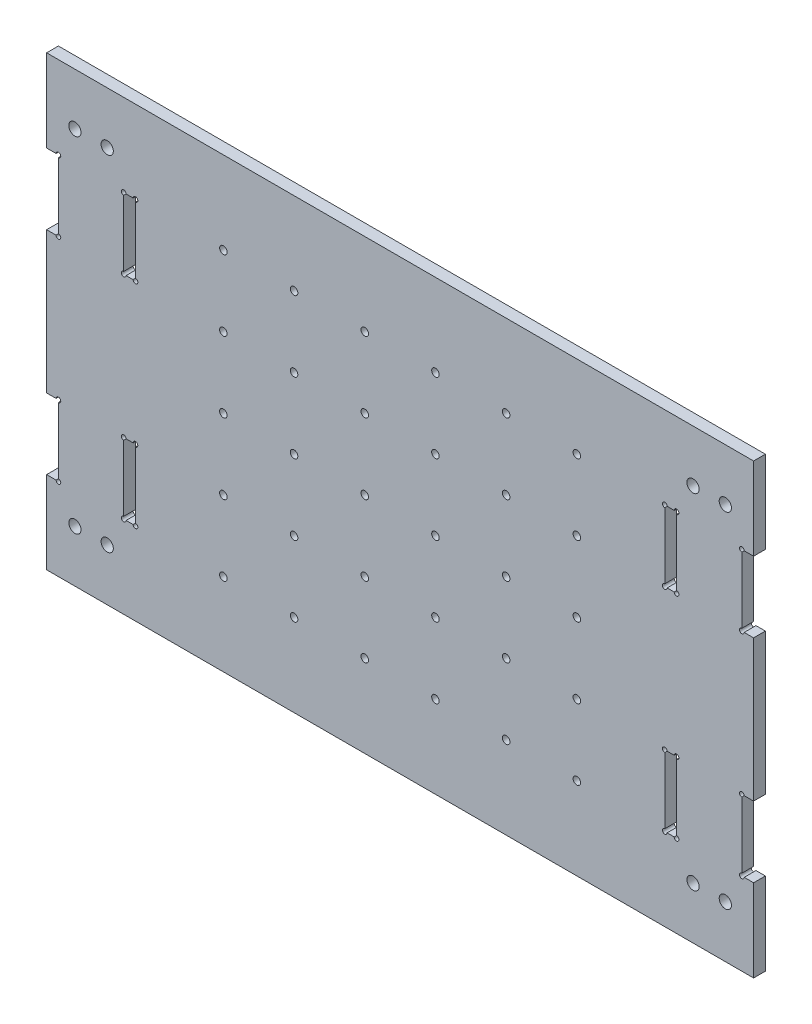
from build123d import *

# Parameters (mm, degrees)
EXTRUDE_2_DEPTH     = 5
SKETCH_2_W          = 5
SKETCH_2_H          = 30
CUT_EXTRUDE_1_DEPTH = 10
SKETCH_3_R          = 1
CUT_EXTRUDE_2_DEPTH = 10
EXTRUDE_3_REACH     = 316.046
SKETCH_4_W          = 5
SKETCH_4_H          = 50
CUT_EXTRUDE_3_DEPTH = 5
SKETCH_6_R          = 2.6
CUT_EXTRUDE_4_DEPTH = 356.140817142
SKETCH_7_R          = 1.6
CUT_EXTRUDE_5_DEPTH = 356.140817142


with BuildPart() as part:
    # 草图1 → 凸台-拉伸2 (new body)
    with BuildSketch(Plane.XY):
        Polygon((0, 0), (0, -190), (50, -190), (50, -140), (250, -140), (250, -190), (300, -190), (300, 0), (250, 0), (250, -50), (50, -50), (50, 0), align=None)
    extrude(amount=EXTRUDE_2_DEPTH)

    # 草图2 → 切除-拉伸1 (cut)
    with BuildSketch(Plane.XY.offset(5)):
        with Locations((2.5, -50)):
            Rectangle(SKETCH_2_W, SKETCH_2_H)
        with Locations((2.5, -140)):
            Rectangle(SKETCH_2_W, SKETCH_2_H)
        with Locations((297.5, -50)):
            Rectangle(SKETCH_2_W, SKETCH_2_H)
        with Locations((297.5, -140)):
            Rectangle(SKETCH_2_W, SKETCH_2_H)
    extrude(amount=-CUT_EXTRUDE_1_DEPTH, mode=Mode.SUBTRACT)

    # 草图3 → 切除-拉伸2 (cut)
    with BuildSketch(Plane.XY.offset(5)):
        with BuildLine():
            Line((5, -65), (4, -65))
            ThreePointArc((4, -65), (5.707106781, -65.707106781), (5, -64))
            Line((5, -64), (5, -65))
        make_face()
        with BuildLine():
            ThreePointArc((5, -126), (5.707106781, -124.292893219), (4, -125))
            Line((4, -125), (5, -125))
            Line((5, -125), (5, -126))
        make_face()
        with BuildLine():
            Line((295, -125), (296, -125))
            ThreePointArc((296, -125), (294.292893219, -124.292893219), (295, -126))
            Line((295, -126), (295, -125))
        make_face()
        with BuildLine():
            ThreePointArc((295, -64), (294.292893219, -65.707106781), (296, -65))
            Line((296, -65), (295, -65))
            Line((295, -65), (295, -64))
        make_face()
        with Locations((5, -35)):
            Circle(SKETCH_3_R)
        with BuildLine():
            ThreePointArc((4, -155), (5.707106781, -155.707106781), (5, -154))
            Line((5, -154), (5, -155))
            Line((5, -155), (4, -155))
        make_face()
        with BuildLine():
            Line((295, -155), (295, -154))
            ThreePointArc((295, -154), (294.292893219, -155.707106781), (296, -155))
            Line((296, -155), (295, -155))
        make_face()
        with BuildLine():
            ThreePointArc((296, -35), (294.292893219, -34.292893219), (295, -36))
            Line((295, -36), (295, -35))
            Line((295, -35), (296, -35))
        make_face()
    extrude(amount=-CUT_EXTRUDE_2_DEPTH, mode=Mode.SUBTRACT)

    # 草图4 → 凸台-拉伸3 (add, up to next)
    with BuildSketch(Plane(origin=(50, 0, 0), x_dir=(0, 0, -1), z_dir=(1, 0, 0)), mode=Mode.PRIVATE) as extrude_3_sk1:
        with Locations((-2.5, -25)):
            Rectangle(SKETCH_4_W, SKETCH_4_H)
    extrude_3_tool1 = extrude(extrude_3_sk1.sketch, amount=EXTRUDE_3_REACH, mode=Mode.PRIVATE) - part.part
    # 草图4 → 凸台-拉伸3 (add, up to next)
    with BuildSketch(Plane(origin=(50, 0, 0), x_dir=(0, 0, -1), z_dir=(1, 0, 0)), mode=Mode.PRIVATE) as extrude_3_sk2:
        with Locations((-2.5, -165)):
            Rectangle(SKETCH_4_W, SKETCH_4_H)
    extrude_3_tool2 = extrude(extrude_3_sk2.sketch, amount=EXTRUDE_3_REACH, mode=Mode.PRIVATE) - part.part
    add(extrude_3_tool1.solids().sort_by_distance((50, -25, 2.5))[0])
    add(extrude_3_tool2.solids().sort_by_distance((50, -165, 2.5))[0])

    # 草图5 → 切除-拉伸3 (cut)
    with BuildSketch(Plane.XY.offset(5)):
        with BuildLine():
            ThreePointArc((33.7, -35), (31.992893219, -34.292893219), (32.7, -36))
            Line((32.7, -36), (32.7, -64))
            ThreePointArc((32.7, -64), (31.992893219, -65.707106781), (33.7, -65))
            Line((33.7, -65), (36.7, -65))
            ThreePointArc((36.7, -65), (38.407106781, -65.707106781), (37.7, -64))
            Line((37.7, -64), (37.7, -36))
            ThreePointArc((37.7, -36), (38.407106781, -34.292893219), (36.7, -35))
            Line((36.7, -35), (33.7, -35))
        make_face()
        with BuildLine():
            ThreePointArc((33.7, -125), (31.992893219, -124.292893219), (32.7, -126))
            Line((32.7, -126), (32.7, -154))
            ThreePointArc((32.7, -154), (31.992893219, -155.707106781), (33.7, -155))
            Line((33.7, -155), (36.7, -155))
            ThreePointArc((36.7, -155), (38.407106781, -155.707106781), (37.7, -154))
            Line((37.7, -154), (37.7, -126))
            ThreePointArc((37.7, -126), (38.407106781, -124.292893219), (36.7, -125))
            Line((36.7, -125), (33.7, -125))
        make_face()
        with BuildLine():
            ThreePointArc((266.3, -155), (268.007106781, -155.707106781), (267.3, -154))
            Line((267.3, -154), (267.3, -126))
            ThreePointArc((267.3, -126), (268.007106781, -124.292893219), (266.3, -125))
            Line((266.3, -125), (263.3, -125))
            ThreePointArc((263.3, -125), (261.592893219, -124.292893219), (262.3, -126))
            Line((262.3, -126), (262.3, -154))
            ThreePointArc((262.3, -154), (261.592893219, -155.707106781), (263.3, -155))
            Line((263.3, -155), (266.3, -155))
        make_face()
        with BuildLine():
            ThreePointArc((262.3, -64), (261.592893219, -65.707106781), (263.3, -65))
            Line((263.3, -65), (266.3, -65))
            ThreePointArc((266.3, -65), (268.007106781, -65.707106781), (267.3, -64))
            Line((267.3, -64), (267.3, -36))
            ThreePointArc((267.3, -36), (268.007106781, -34.292893219), (266.3, -35))
            Line((266.3, -35), (263.3, -35))
            ThreePointArc((263.3, -35), (261.592893219, -34.292893219), (262.3, -36))
            Line((262.3, -36), (262.3, -64))
        make_face()
    extrude(amount=-CUT_EXTRUDE_3_DEPTH, mode=Mode.SUBTRACT)

    # 草图6 → 切除-拉伸4 (cut, through all)
    with BuildSketch(Plane.XY.offset(5)):
        with Locations((12, -168)):
            Circle(SKETCH_6_R)
        with Locations((25.7, -168)):
            Circle(SKETCH_6_R)
        with Locations((25.7, -22)):
            Circle(SKETCH_6_R)
        with Locations((12, -22)):
            Circle(SKETCH_6_R)
        with Locations((274.3, -168)):
            Circle(SKETCH_6_R)
        with Locations((288, -168)):
            Circle(SKETCH_6_R)
        with Locations((274.3, -22)):
            Circle(SKETCH_6_R)
        with Locations((288, -22)):
            Circle(SKETCH_6_R)
    extrude(amount=-CUT_EXTRUDE_4_DEPTH, mode=Mode.SUBTRACT)

    # 草图7 → 切除-拉伸5 (cut, through all)
    with BuildSketch(Plane.XY.offset(5)):
        with Locations((75, -35)):
            Circle(SKETCH_7_R)
        with Locations((105, -35)):
            Circle(SKETCH_7_R)
        with Locations((135, -35)):
            Circle(SKETCH_7_R)
        with Locations((165, -35)):
            Circle(SKETCH_7_R)
        with Locations((195, -35)):
            Circle(SKETCH_7_R)
        with Locations((225, -35)):
            Circle(SKETCH_7_R)
        with Locations((105, -65)):
            Circle(SKETCH_7_R)
        with Locations((135, -65)):
            Circle(SKETCH_7_R)
        with Locations((165, -65)):
            Circle(SKETCH_7_R)
        with Locations((195, -65)):
            Circle(SKETCH_7_R)
        with Locations((225, -65)):
            Circle(SKETCH_7_R)
        with Locations((105, -95)):
            Circle(SKETCH_7_R)
        with Locations((135, -95)):
            Circle(SKETCH_7_R)
        with Locations((165, -95)):
            Circle(SKETCH_7_R)
        with Locations((195, -95)):
            Circle(SKETCH_7_R)
        with Locations((225, -95)):
            Circle(SKETCH_7_R)
        with Locations((105, -125)):
            Circle(SKETCH_7_R)
        with Locations((135, -125)):
            Circle(SKETCH_7_R)
        with Locations((165, -125)):
            Circle(SKETCH_7_R)
        with Locations((195, -125)):
            Circle(SKETCH_7_R)
        with Locations((225, -125)):
            Circle(SKETCH_7_R)
        with Locations((105, -155)):
            Circle(SKETCH_7_R)
        with Locations((135, -155)):
            Circle(SKETCH_7_R)
        with Locations((165, -155)):
            Circle(SKETCH_7_R)
        with Locations((195, -155)):
            Circle(SKETCH_7_R)
        with Locations((225, -155)):
            Circle(SKETCH_7_R)
        with Locations((75, -65)):
            Circle(SKETCH_7_R)
        with Locations((75, -95)):
            Circle(SKETCH_7_R)
        with Locations((75, -125)):
            Circle(SKETCH_7_R)
        with Locations((75, -155)):
            Circle(SKETCH_7_R)
    extrude(amount=-CUT_EXTRUDE_5_DEPTH, mode=Mode.SUBTRACT)


solid = part.part
